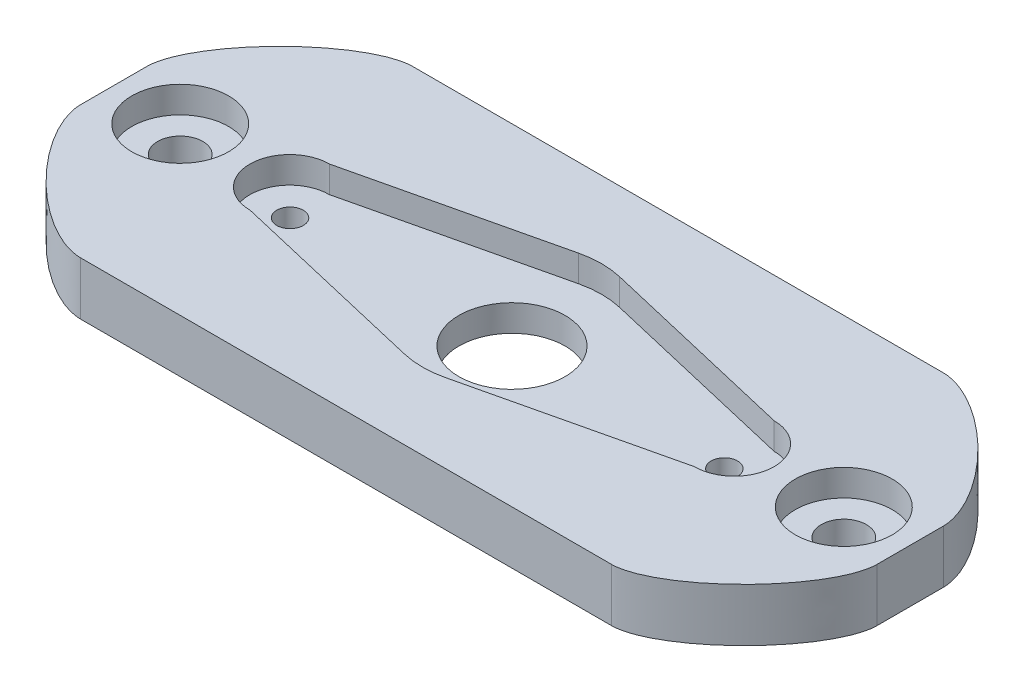
from build123d import *

# Parameters (mm, degrees)
SKETCH1_W           = 60
SKETCH1_H           = 8
BOSS_EXTRUDE1_DEPTH = 25
SKETCH2_W           = 60
SKETCH2_H           = 2
CUT_EXTRUDE1_DEPTH  = 22
CUT_EXTRUDE2_DEPTH  = 2
SKETCH4_R           = 1
SKETCH4_R_2         = 4
CUT_EXTRUDE3_DEPTH  = 2.5
SKETCH5_R           = 1.7
CUT_EXTRUDE4_DEPTH  = 9
FILLET2_SIZE        = 10
SKETCH6_R           = 3
CUT_EXTRUDE5_DEPTH  = 4.5
CUT_EXTRUDE6_DEPTH  = 1
SKETCH8_R           = 3.65
CUT_EXTRUDE7_DEPTH  = 2
SKETCH10_W          = 50
SKETCH10_H          = 4
CUT_EXTRUDE8_DEPTH  = 61


with BuildPart() as part:
    # Sketch1 → Boss-Extrude1 (new body)
    with BuildSketch(Plane.XY):
        with Locations((9.92851316, -6.03519833)):
            Rectangle(SKETCH1_W, SKETCH1_H)
    extrude(amount=BOSS_EXTRUDE1_DEPTH)

    # Sketch2 → Cut-Extrude1 (cut)
    with BuildSketch(Plane.XY.offset(25)):
        with Locations((9.92851316, -7.03519833)):
            Rectangle(SKETCH2_W, SKETCH2_H)
    extrude(amount=-CUT_EXTRUDE1_DEPTH, mode=Mode.SUBTRACT)

    # Sketch3 → Cut-Extrude2 (cut)
    with BuildSketch(Plane(origin=(0, -2.03519833, 0), x_dir=(1, 0, 0), z_dir=(0, 1, 0))):
        with BuildLine():
            Line((26.67851316, -9.5), (11.471726674, -5.928775453))
            ThreePointArc((11.471726674, -5.928775453), (9.92851316, -5.75), (8.385299646, -5.928775453))
            Line((8.385299646, -5.928775453), (-6.82148684, -9.5))
            ThreePointArc((-6.82148684, -9.5), (-9.821486841, -12.5), (-6.82148684, -15.5))
            Line((-6.82148684, -15.5), (8.385299646, -19.071224547))
            ThreePointArc((8.385299646, -19.071224547), (9.92851316, -19.25), (11.471726674, -19.071224547))
            Line((11.471726674, -19.071224547), (26.67851316, -15.5))
            ThreePointArc((26.67851316, -15.5), (29.67851316, -12.5), (26.67851316, -9.5))
        make_face()
    extrude(amount=-CUT_EXTRUDE2_DEPTH, mode=Mode.SUBTRACT)

    # Sketch4 → Cut-Extrude3 (cut)
    with BuildSketch(Plane(origin=(0, -4.03519833, 0), x_dir=(1, 0, 0), z_dir=(0, 1, 0))):
        with Locations(Location((-6.796927173, -12.5, 0), (0, 0, 270))):
            Circle(SKETCH4_R)
        with Locations(Location((9.92851316, -12.5, 0), (0, 0, 270))):
            Circle(SKETCH4_R_2)
        with Locations(Location((25.92851316, -12.5, 0), (0, 0, 270))):
            Circle(SKETCH4_R)
    extrude(amount=-CUT_EXTRUDE3_DEPTH, mode=Mode.SUBTRACT)

    # Sketch5 → Cut-Extrude4 (cut)
    with BuildSketch(Plane(origin=(0, -2.03519833, 0), x_dir=(1, 0, 0), z_dir=(0, 1, 0))):
        with Locations(Location((34.92851316, -12.5, 0), (0, 0, 270))):
            Circle(SKETCH5_R)
        with Locations(Location((-15.07148684, -12.5, 0), (0, 0, 270))):
            Circle(SKETCH5_R)
    extrude(amount=-CUT_EXTRUDE4_DEPTH, mode=Mode.SUBTRACT)

    # Fillet2
    # a fillet whose section is not a circle: 10 mm, written as the material it takes off along each edge
    with BuildSketch(Plane(origin=(-20.07148684, -31.03519833, 25), x_dir=(0, 0, -1), z_dir=(0, 1, 0))) as fillet2_piece_1:
        with BuildLine():
            Bezier((FILLET2_SIZE, 0), (0, 0), (0, -FILLET2_SIZE), weights=[1, 0.353553391, 1])
            Line((0, -FILLET2_SIZE), (0, 0))
            Line((0, 0), (FILLET2_SIZE, 0))
        make_face()
    extrude(amount=54, mode=Mode.SUBTRACT)
    with BuildSketch(Plane(origin=(-20.07148684, -35.03519833, 25), x_dir=(0, 0, -1), z_dir=(0, 1, 0)), Plane(origin=(39.92851316, 16.96480167, 25), x_dir=(0, 0, -1), z_dir=(0, -1, 0))) as fillet2_piece_2:
        with BuildLine():
            Bezier((FILLET2_SIZE, 0), (0, 0), (0, -FILLET2_SIZE), weights=[1, 0.353553391, 1])
            Line((0, -FILLET2_SIZE), (0, 0))
            Line((0, 0), (FILLET2_SIZE, 0))
        make_face()
    extrude(amount=52, mode=Mode.SUBTRACT)
    with BuildSketch(Plane(origin=(39.92851316, 22.96480167, 25), x_dir=(-1, 0, 0), z_dir=(0, -1, 0))) as fillet2_piece_3:
        with BuildLine():
            Bezier((FILLET2_SIZE, 0), (0, 0), (0, FILLET2_SIZE), weights=[1, 0.353553391, 1])
            Line((0, FILLET2_SIZE), (0, 0))
            Line((0, 0), (FILLET2_SIZE, 0))
        make_face()
    extrude(amount=54, mode=Mode.SUBTRACT)
    with BuildSketch(Plane(origin=(39.92851316, 22.96480167, 0), x_dir=(-1, 0, 0), z_dir=(0, -1, 0))) as fillet2_piece_4:
        with BuildLine():
            Bezier((FILLET2_SIZE, 0), (0, 0), (0, -FILLET2_SIZE), weights=[1, 0.353553391, 1])
            Line((0, -FILLET2_SIZE), (0, 0))
            Line((0, 0), (FILLET2_SIZE, 0))
        make_face()
    extrude(amount=58, mode=Mode.SUBTRACT)
    with BuildSketch(Plane(origin=(-20.07148684, -35.03519833, 0), x_dir=(0, 0, 1), z_dir=(0, 1, 0))) as fillet2_piece_5:
        with BuildLine():
            Bezier((FILLET2_SIZE, 0), (0, 0), (0, FILLET2_SIZE), weights=[1, 0.353553391, 1])
            Line((0, FILLET2_SIZE), (0, 0))
            Line((0, 0), (FILLET2_SIZE, 0))
        make_face()
    extrude(amount=58, mode=Mode.SUBTRACT)

    # Sketch6 → Cut-Extrude5 (cut)
    with BuildSketch(Plane(origin=(0, -8.03519833, 0), x_dir=(1, 0, 0), z_dir=(0, 1, 0))):
        with Locations(Location((9.92851316, -12.5, 0), (0, 0, 270))):
            Circle(SKETCH6_R)
    extrude(amount=-CUT_EXTRUDE5_DEPTH, mode=Mode.SUBTRACT)

    # Sketch7 → Cut-Extrude6 (cut)
    with BuildSketch(Plane(origin=(0, -10.03519833, 0), x_dir=(-1, 0, 0), z_dir=(0, -1, 0))):
        Polygon((-35.683884991, -9.237677709), (-38.131453055, -11.52301005), (-37.376081224, -14.785332341), (-34.173141329, -15.762322291), (-31.725573265, -13.47698995), (-32.480945096, -10.214667659), align=None)
        Polygon((12.105656047, -10.945271393), (12.242136974, -14.291120506), (15.207967766, -15.845849113), (18.037317633, -14.054728607), (17.900836706, -10.708879494), (14.935005914, -9.154150887), align=None)
    extrude(amount=-CUT_EXTRUDE6_DEPTH, mode=Mode.SUBTRACT)

    # Sketch8 → Cut-Extrude7 (cut)
    with BuildSketch(Plane(origin=(0, -2.03519833, 0), x_dir=(1, 0, 0), z_dir=(0, 1, 0))):
        with Locations(Location((-15.07148684, -12.5, 0), (0, 0, 270))):
            Circle(SKETCH8_R)
        with Locations(Location((34.92851316, -12.5, 0), (0, 0, 270))):
            Circle(SKETCH8_R)
    extrude(amount=-CUT_EXTRUDE7_DEPTH, mode=Mode.SUBTRACT)

    # Sketch10 → Cut-Extrude8 (cut)
    with BuildSketch(Plane.ZY.offset(20.07148684)):
        with Locations((25, -8.03519833)):
            Rectangle(SKETCH10_W, SKETCH10_H)
    extrude(amount=-CUT_EXTRUDE8_DEPTH, mode=Mode.SUBTRACT)


solid = part.part
